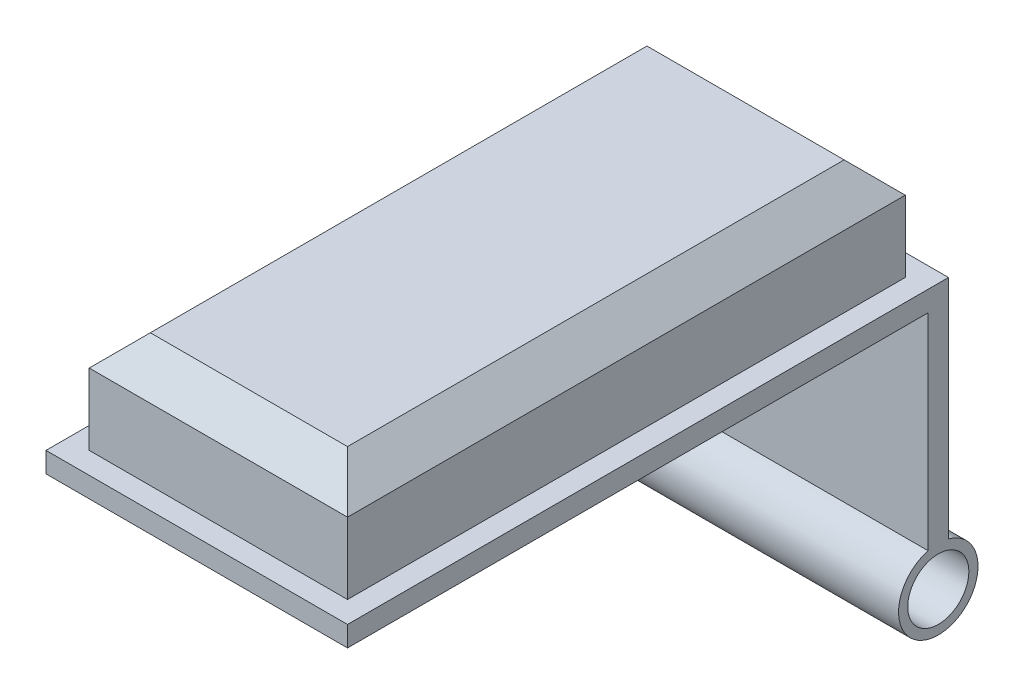
from build123d import *

# Parameters (mm, degrees)
BOSS_EXTRUDE1_DEPTH = 14.8
SKETCH4_W           = 14.8
SKETCH4_H           = 28.498993342
BOSS_EXTRUDE2_DEPTH = 1
SKETCH5_W           = 12.678679656
SKETCH5_H           = 27.377672998
BOSS_EXTRUDE3_DEPTH = 5
CHAMFER1_SIZE       = 1.5


with BuildPart() as part:
    # Sketch1 → Boss-Extrude1 (new body)
    with BuildSketch(Plane(origin=(0, 0, 0), x_dir=(0, 0, -1), z_dir=(1, 0, 0))):
        with BuildLine():
            Line((0.498993342, 12.996913423), (-0.000472168, 12.996913423))
            Line((-0.000472168, 12.996913423), (-0.501006658, 12.996913423))
            Line((-0.501006658, 12.996913423), (-0.501006658, 1.881579236))
            ThreePointArc((-0.501006658, 1.881579236), (8.0809e-05, -1.953086498), (0.498993342, 1.881862814))
            Line((0.498993342, 1.881862814), (0.498993342, 12.996913423))
        make_face()
        with BuildLine():
            ThreePointArc((-0.000472168, 1.496913423), (1.060188004, 1.057573595), (1.499527832, -0.003086577))
            ThreePointArc((1.499527832, -0.003086577), (-1.06113234, -1.063746748), (-0.000472168, 1.496913423))
        make_face(mode=Mode.SUBTRACT)
    extrude(amount=BOSS_EXTRUDE1_DEPTH)

    # Sketch4 → Boss-Extrude2 (add)
    with BuildSketch(Plane(origin=(0, 12.996913423, 0), x_dir=(1, 0, 0), z_dir=(0, 1, 0))):
        with Locations((7.4, -14.750503329)):
            Rectangle(SKETCH4_W, SKETCH4_H)
    extrude(amount=-BOSS_EXTRUDE2_DEPTH)

    # Sketch5 → Boss-Extrude3 (add)
    with BuildSketch(Plane(origin=(0, 12.996913423, 0), x_dir=(1, 0, 0), z_dir=(0, 1, 0))):
        with Locations((7.4, -14.250503329)):
            Rectangle(SKETCH5_W, SKETCH5_H)
    extrude(amount=BOSS_EXTRUDE3_DEPTH)

    # Chamfer1
    chamfer1_edges = [part.edges().sort_by_distance(p)[0] for p in [
        (7.4, 17.996913423, 27.939339828),
        (1.060660172, 17.996913423, 14.250503329),
        (7.4, 17.996913423, 0.56166683),
        (13.739339828, 17.996913423, 14.250503329),
    ]]
    chamfer(chamfer1_edges, length=CHAMFER1_SIZE)


with BuildPart() as body_2:
    # Split1: the piece on the far side of the plane
    add(part.part)
    split(bisect_by=Plane(origin=(14.8, 12.996913423, 0), x_dir=(0, 0, 1), z_dir=(0, 1, 0)), keep=Keep.BOTTOM)


with BuildPart() as part_1:
    add(part.part)

    # Split1
    split(bisect_by=Plane(origin=(14.8, 12.996913423, 0), x_dir=(0, 0, 1), z_dir=(0, 1, 0)), keep=Keep.TOP)


solid = Compound([body_2.part, part_1.part])
